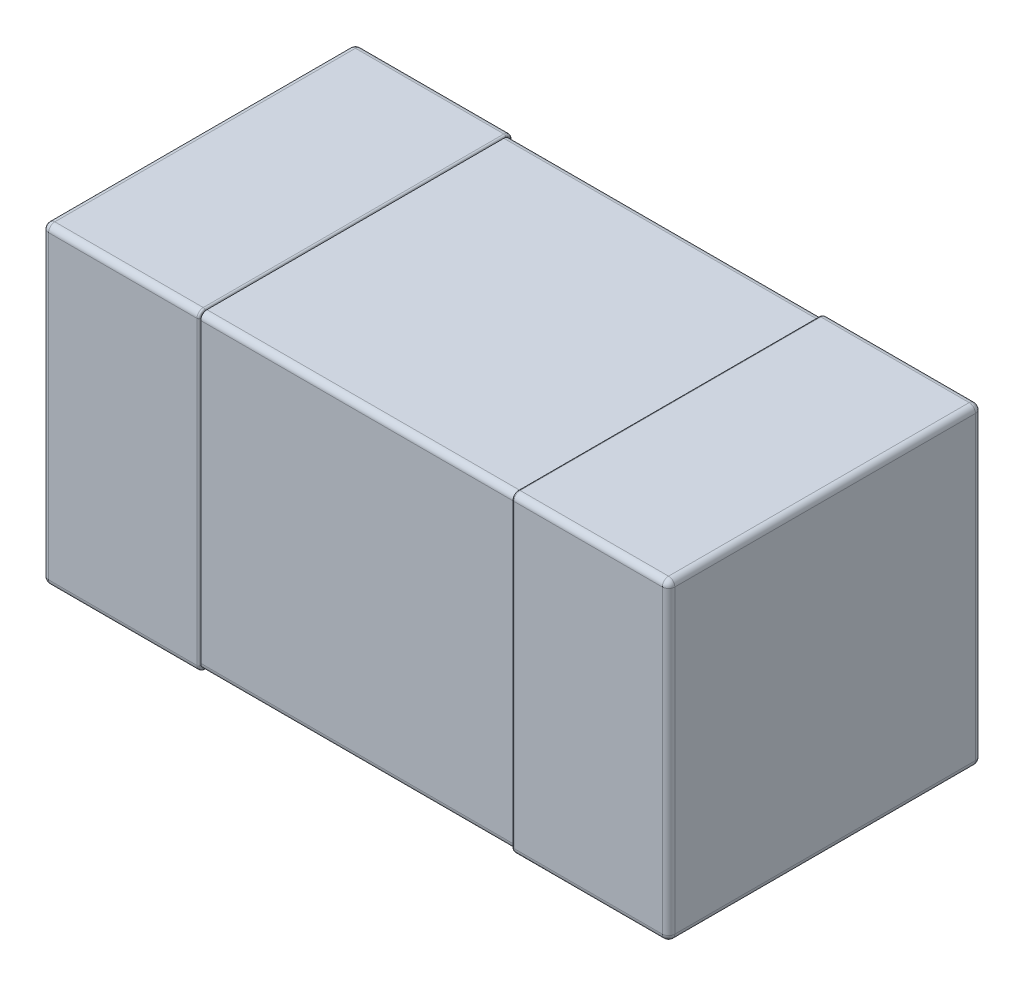
from build123d import *

# Parameters (mm, degrees)
SKETCH1_W                           = 1
SKETCH1_H                           = 0.5
ALL_BODY_DEPTH                      = 0.5
CUT_OUT_THE_BODY_FOR_PIN_DEPTH      = 0.25
CUT_OUT_THE_BODY_FOR_PIN_DEPTH_BACK = 0.25
SKETCH2_OUTSIDE_W                   = 2.744
SKETCH2_OUTSIDE_H                   = 2.744
SKETCH2_OUTSIDE_W_2                 = 0.494
SKETCH2_OUTSIDE_H_2                 = 0.494
BODY_FILLET_R                       = 0.01
PIN_FILLET_A_R                      = 0.01
PIN_FILLET_B_R                      = 0.003


with BuildPart() as part:
    # Sketch1 → All body (new body)
    with BuildSketch(Plane.XY):
        Rectangle(SKETCH1_W, SKETCH1_H)
    extrude(amount=ALL_BODY_DEPTH)

    # Sketch2 outside → Cut out the body for pin (cut, two sides: drawn at the far end of the back side and taken through both)
    with BuildSketch(Plane(origin=(0, 0, 0), x_dir=(0, 0, -1), z_dir=(1, 0, 0)).offset(-CUT_OUT_THE_BODY_FOR_PIN_DEPTH_BACK)):
        with Locations((-0.25, 0)):
            Rectangle(SKETCH2_OUTSIDE_W, SKETCH2_OUTSIDE_H)
        with Locations((-0.25, 0)):
            Rectangle(SKETCH2_OUTSIDE_W_2, SKETCH2_OUTSIDE_H_2, mode=Mode.SUBTRACT)
    extrude(amount=CUT_OUT_THE_BODY_FOR_PIN_DEPTH + CUT_OUT_THE_BODY_FOR_PIN_DEPTH_BACK, mode=Mode.SUBTRACT)

    # Body fillet
    body_fillet_edges = [part.edges().sort_by_distance(p)[0] for p in [
        (0, 0.247, 0.003),
        (0, 0.247, 0.497),
        (0, -0.247, 0.497),
        (0, -0.247, 0.003),
    ]]
    fillet(body_fillet_edges, radius=BODY_FILLET_R)

    # Pin fillet a
    pin_fillet_a_edges = [part.edges().sort_by_distance(p)[0] for p in [
        (0.5, 0, 0.5),
        (-0.375, 0.25, 0),
        (0.375, -0.25, 0),
        (0.375, -0.25, 0.5),
        (-0.375, 0.25, 0.5),
        (0.375, 0.25, 0.5),
        (-0.5, 0, 0.5),
        (0.375, 0.25, 0),
        (0.5, 0, 0),
        (-0.375, -0.25, 0),
        (-0.5, 0, 0),
        (-0.5, 0.25, 0.25),
        (0.5, 0.25, 0.25),
        (0.5, -0.25, 0.25),
        (-0.5, -0.25, 0.25),
        (-0.375, -0.25, 0.5),
    ]]
    fillet(pin_fillet_a_edges, radius=PIN_FILLET_A_R)

    # Pin fillet b
    pin_fillet_b_edges = [part.edges().sort_by_distance(p)[0] for p in [
        (0.25, -0.25, 0.25),
        (0.25, 0, 0.5),
        (0.25, 0.25, 0.25),
        (0.25, 0, 0),
        (-0.25, 0.25, 0.25),
        (-0.25, 0, 0.5),
        (-0.25, -0.25, 0.25),
        (-0.25, 0, 0),
        (0.25, 0.247071068, 0.002928932),
        (0.25, -0.247071068, 0.002928932),
        (0.25, -0.247071068, 0.497071068),
        (0.25, 0.247071068, 0.497071068),
        (-0.25, -0.247071068, 0.497071068),
        (-0.25, 0.247071068, 0.497071068),
        (-0.25, -0.247071068, 0.002928932),
        (-0.25, 0.247071068, 0.002928932),
    ]]
    fillet(pin_fillet_b_edges, radius=PIN_FILLET_B_R - 0.0001)  # a hair under: the kernel refuses the full size


solid = part.part
